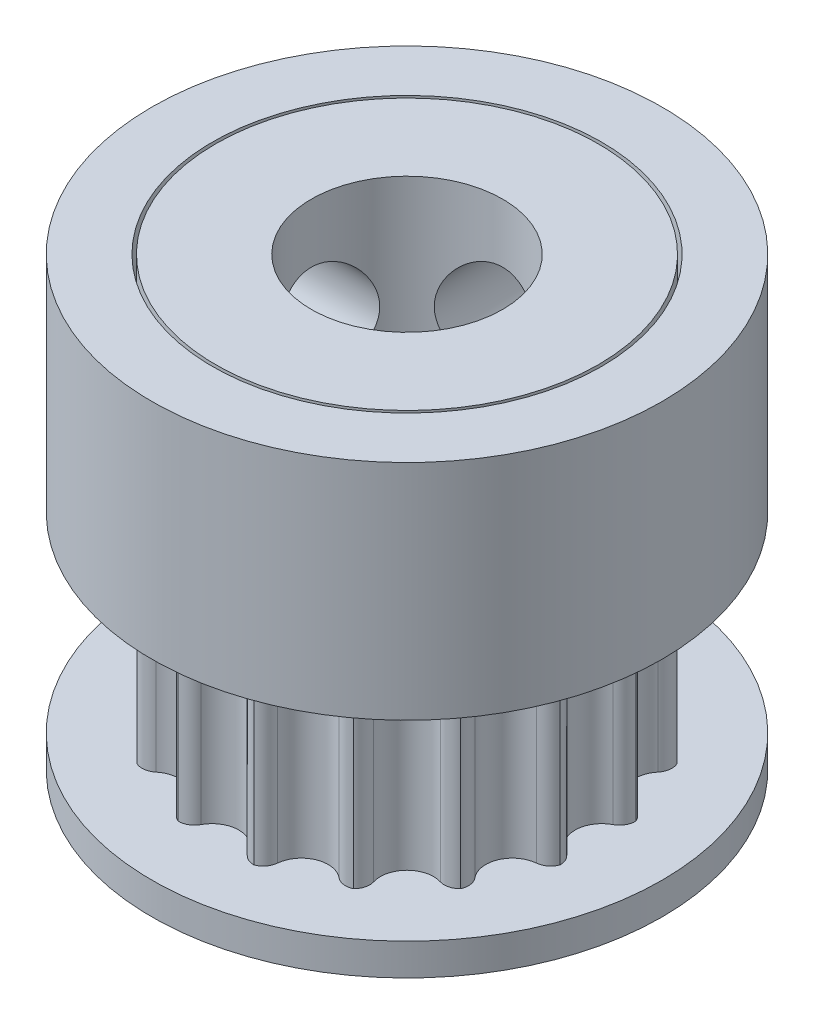
from build123d import *

# Parameters (mm, degrees)
CUT_EXTRUDE1_DEPTH      = 6
CIRPATTERN1_COUNT       = 16
CUT_EXTRUDE2_REACH      = 15.574
CUT_EXTRUDE2_END_RADIUS = 8
SKETCH3_R               = 1.65
CUT_EXTRUDE3_REACH      = 15.574
CUT_EXTRUDE3_END_RADIUS = 8
SKETCH4_R               = 1.65
SKETCH5_R               = 6.1
SKETCH5_R_2             = 6
CUT_EXTRUDE_THIN1_DEPTH = 5
CHAMFER1_SIZE           = 1


with BuildPart() as part:
    # Skica2 → Revolute (revolve)
    with BuildSketch(Plane.XY):
        Polygon((8, 7.5), (3, 7.5), (3, -7.5), (6.11, -7.5), (6.11, -6.5), (8, -6.5), (8, -5.5), (6.11, -5.5), (6.11, 0.5), (8, 0.5), align=None)
    revolve(axis=Axis((0, -7.5, 0), (0, 1, 0)))

    # Sketch2 → Cut-Extrude1 (cut)
    with BuildSketch(Plane.XZ.offset(-0.5)):
        with BuildLine():
            ThreePointArc((-1.285657138, 5.973205649), (-0.969411866, 5.937681099), (-0.73865565, 5.718535862))
            ThreePointArc((-0.73865565, 5.718535862), (0, 5.27402372), (0.73865565, 5.718535862))
            ThreePointArc((0.73865565, 5.718535862), (0.969411866, 5.937681099), (1.285657138, 5.973205649))
            ThreePointArc((1.285657138, 5.973205649), (0, 6.11), (-1.285657138, 5.973205649))
        make_face()
    cut_extrude1 = extrude(amount=CUT_EXTRUDE1_DEPTH, mode=Mode.SUBTRACT)

    # CirPattern1: Cut-Extrude1 ×16 about axis
    cirpattern1_axis = Axis((0, 0, 0), (0, 1, 0))
    for i in range(1, CIRPATTERN1_COUNT):
        add(cut_extrude1.rotate(cirpattern1_axis, i * 360 / CIRPATTERN1_COUNT), mode=Mode.SUBTRACT)

    # Cut-Extrude2: up to this cylinder (the profile starts inside it)
    cut_extrude2_end = Plane(origin=(0, 4, 0), z_dir=(0, -1, 0)) * Cylinder(CUT_EXTRUDE2_END_RADIUS, 48.148, mode=Mode.PRIVATE)
    # Sketch3 → Cut-Extrude2 (cut, up to the surface)
    with BuildSketch(Plane(origin=(0, 0, 0), x_dir=(0, 0, -1), z_dir=(1, 0, 0)), mode=Mode.PRIVATE) as cut_extrude2_sk1:
        with Locations((0, 4)):
            Circle(SKETCH3_R)
    cut_extrude2_tool1 = extrude(cut_extrude2_sk1.sketch, amount=-CUT_EXTRUDE2_REACH, mode=Mode.PRIVATE) & cut_extrude2_end
    add(cut_extrude2_tool1.solids().sort_by_distance((0, 4, 0))[0], mode=Mode.SUBTRACT)

    # Cut-Extrude3: up to this cylinder (the profile starts inside it)
    cut_extrude3_end = Plane(origin=(0, 4, 0), z_dir=(0, -1, 0)) * Cylinder(CUT_EXTRUDE3_END_RADIUS, 48.148, mode=Mode.PRIVATE)
    # Sketch4 → Cut-Extrude3 (cut, up to the surface)
    with BuildSketch(Plane.XY, mode=Mode.PRIVATE) as cut_extrude3_sk1:
        with Locations((0, 4)):
            Circle(SKETCH4_R)
    cut_extrude3_tool1 = extrude(cut_extrude3_sk1.sketch, amount=-CUT_EXTRUDE3_REACH, mode=Mode.PRIVATE) & cut_extrude3_end
    add(cut_extrude3_tool1.solids().sort_by_distance((0, 4, 0))[0], mode=Mode.SUBTRACT)

    # Sketch5 → Cut-Extrude-Thin1 (cut)
    with BuildSketch(Plane(origin=(0, 7.5, 0), x_dir=(1, 0, 0), z_dir=(0, 1, 0))):
        Circle(SKETCH5_R)
        Circle(SKETCH5_R_2, mode=Mode.SUBTRACT)
    extrude(amount=-CUT_EXTRUDE_THIN1_DEPTH, mode=Mode.SUBTRACT)

    # Chamfer1
    chamfer1_edges = [part.edges().sort_by_distance(p)[0] for p in [
        (-6.11, -6.5, 0),
    ]]
    chamfer(chamfer1_edges, length=CHAMFER1_SIZE - 0.0001)  # a hair under: the kernel refuses the full size


solid = part.part
